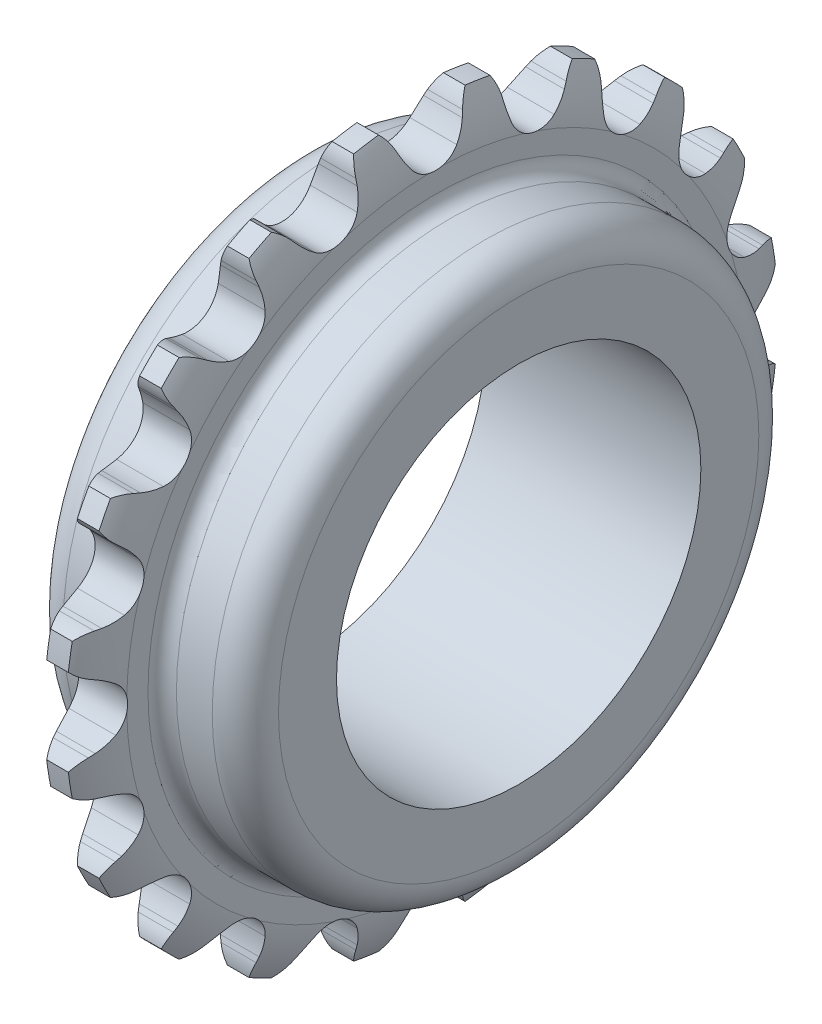
from build123d import *

# Parameters (mm, degrees)
EXTRUDECUTONE_DEPTH     = 2.551719489
PATTERNONE_COUNT        = 20
CUT_EXTRUDEA_DEPTH      = 31.288553175
CUT_EXTRUDEA_DEPTH_BACK = 31.288553175
SKETCHHOLE_R            = 5
CUT_EXTRUDEB_DEPTH      = 31.288553175
CUT_EXTRUDEB_DEPTH_BACK = 31.288553175
SKETCHKEY_W             = 3
SKETCHKEY_H             = 3.899999976
SKETCH_1_R              = 6.573431349
EXTRUDE_1_DEPTH         = 5.103438978
SKETCH_3_R              = 16.5
EXTRUDE_2_DEPTH         = 6.5
SKETCH_4_R              = 11
CUT_EXTRUDE_1_DEPTH     = 42.5
FILLET_1_R              = 2


with BuildPart() as part:
    # Sketch1 → Revolve 2 (revolve)
    with BuildSketch(Plane.XY, mode=Mode.PRIVATE) as revolve_2_sk:
        with BuildLine():
            Line((-2.551719489, 0), (-2.551719489, 16.5))
            Line((-2.551719489, 16.5), (-2.337115591, 16.5))
            ThreePointArc((-2.337115591, 16.5), (-1.730124106, 16.751424106), (-1.4787, 17.358415591))
            Line((-1.4787, 17.358415591), (-1.4787, 18.646038978))
            ThreePointArc((-1.4787, 18.646038978), (-1.23520718, 20.121976641), (-0.6532, 21.5))
            Line((-0.6532, 21.5), (0.6532, 21.5))
            ThreePointArc((0.6532, 21.5), (1.23520718, 20.121976641), (1.4787, 18.646038978))
            Line((1.4787, 18.646038978), (1.4787, 17.358415591))
            ThreePointArc((1.4787, 17.358415591), (1.730124106, 16.751424106), (2.337115591, 16.5))
            Line((2.337115591, 16.5), (2.551719489, 16.5))
            Line((2.551719489, 16.5), (2.551719489, 0))
            Line((2.551719489, 0), (-2.551719489, 0))
        make_face()
    revolve(revolve_2_sk.sketch.rotate(Axis((-4, 0, 0), (1, 0, 0)), 90), axis=Axis((-4, 0, 0), (1, 0, 0)))

    # Sketch2 → ExtrudeCutOne (cut, symmetric)
    with BuildSketch(Plane(origin=(0, 0, 0), x_dir=(0, 0, -1), z_dir=(1, 0, 0))):
        with BuildLine():
            Line((1.928143059, 20.236370624), (2.056460747, 20.541626341))
            ThreePointArc((2.056460747, 20.541626341), (2.291280828, 20.970051126), (2.609102091, 21.341100869))
            ThreePointArc((2.609102091, 21.341100869), (0, 21.5), (-2.609102091, 21.341100869))
            ThreePointArc((-2.609102091, 21.341100869), (-2.291280828, 20.970051126), (-2.056460747, 20.541626341))
            Line((-2.056460747, 20.541626341), (-1.928143059, 20.236370624))
            ThreePointArc((-1.928143059, 20.236370624), (-1.670076673, 19.721023958), (-1.34611937, 19.244335263))
            ThreePointArc((-1.34611937, 19.244335263), (0, 18.587788978), (1.34611937, 19.244335263))
            ThreePointArc((1.34611937, 19.244335263), (1.670076673, 19.721023958), (1.928143059, 20.236370624))
        make_face()
    extrudecutone = extrude(amount=EXTRUDECUTONE_DEPTH, both=True, mode=Mode.SUBTRACT)

    # PatternOne: ExtrudeCutOne ×20 about axis
    patternone_axis = Axis((0, 0, 0), (1, 0, 0))
    for i in range(1, PATTERNONE_COUNT):
        add(extrudecutone.rotate(patternone_axis, i * 360 / PATTERNONE_COUNT), mode=Mode.SUBTRACT)

    # SketchHole → Cut-ExtrudeA (cut, two sides: drawn at the far end of the back side and taken through both)
    with BuildSketch(Plane(origin=(0, 0, 0), x_dir=(0, 0, -1), z_dir=(1, 0, 0)).offset(-CUT_EXTRUDEA_DEPTH_BACK)):
        Circle(SKETCHHOLE_R)
    extrude(amount=CUT_EXTRUDEA_DEPTH + CUT_EXTRUDEA_DEPTH_BACK, mode=Mode.SUBTRACT)

    # SketchKey → Cut-ExtrudeB (cut, two sides: drawn at the far end of the back side and taken through both)
    with BuildSketch(Plane(origin=(0, 0, 0), x_dir=(0, 0, -1), z_dir=(1, 0, 0)).offset(-CUT_EXTRUDEB_DEPTH_BACK)):
        with Locations((0, 4.449999988)):
            Rectangle(SKETCHKEY_W, SKETCHKEY_H)
    extrude(amount=CUT_EXTRUDEB_DEPTH + CUT_EXTRUDEB_DEPTH_BACK, mode=Mode.SUBTRACT)

    # 草图1 → 凸台-拉伸1 (add)
    with BuildSketch(Plane(origin=(2.551719489, 0, 0), x_dir=(0, 0, -1), z_dir=(1, 0, 0))):
        Circle(SKETCH_1_R)
    extrude(amount=-EXTRUDE_1_DEPTH)

    # 草图3 → 凸台-拉伸2 (add, symmetric)
    with BuildSketch(Plane(origin=(0, 0, 0), x_dir=(0, 0, -1), z_dir=(1, 0, 0))):
        with Locations(Location((0, 0, 0), (0, 0, 180))):
            Circle(SKETCH_3_R)
    extrude(amount=EXTRUDE_2_DEPTH, both=True)

    # 草图4 → 切除-拉伸1 (cut, symmetric)
    with BuildSketch(Plane(origin=(6.5, 0, 0), x_dir=(0, 0, -1), z_dir=(1, 0, 0))):
        Circle(SKETCH_4_R)
    extrude(amount=CUT_EXTRUDE_1_DEPTH, both=True, mode=Mode.SUBTRACT)

    # 圆角1
    fillet_1_edges = [part.edges().sort_by_distance(p)[0] for p in [
        (-6.5, 0, -16.5),
        (6.5, 0, -16.5),
    ]]
    fillet(fillet_1_edges, radius=FILLET_1_R)


solid = part.part
